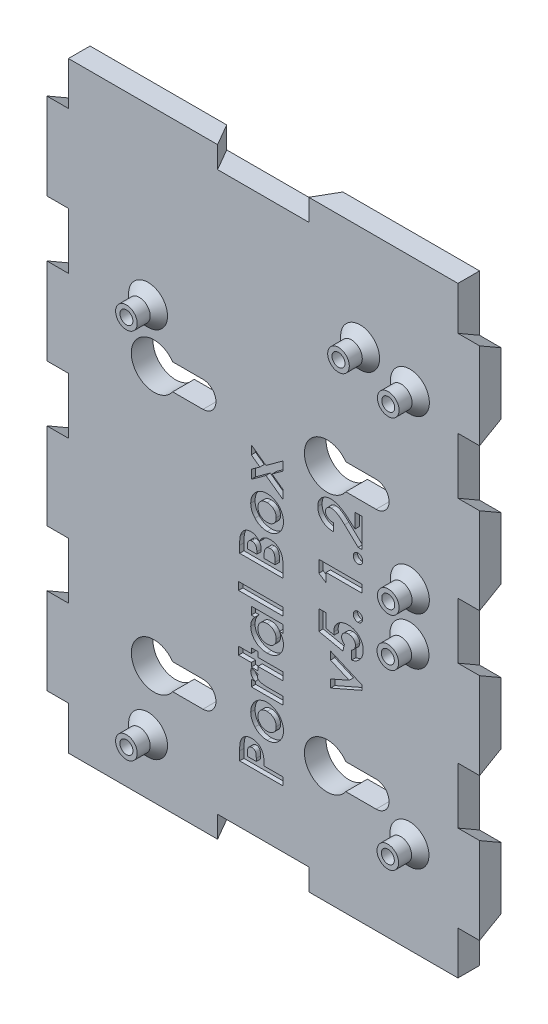
from build123d import *

# Parameters (mm, degrees)
SKETCH2_W           = 139
SKETCH2_H           = 90
BOSS_EXTRUDE1_DEPTH = 5
SKETCH9_W           = 10.256410256
SKETCH9_H           = 1.794871795
CUT_EXTRUDE4_DEPTH  = 1
CUT_EXTRUDE5_START  = -139
CUT_EXTRUDE5_DEPTH  = 5
CUT_EXTRUDE6_DEPTH  = 5
SKETCH11_R          = 2.5
SKETCH11_R_2        = 1.5
BOSS_EXTRUDE4_DEPTH = 5
CHAMFER1_SIZE       = 2
SKETCH14_R          = 3
SKETCH14_R_2        = 5.25
SKETCH14_W          = 7
SKETCH14_H          = 6
CUT_EXTRUDE7_DEPTH  = 10
BOSS_EXTRUDE5_DEPTH = 5
BOSS_EXTRUDE6_START = -95
BOSS_EXTRUDE6_DEPTH = 5


# Read off the part's stored shape, not the designer's step: Boss-Extrude6
with BuildPart() as part:
    # Sketch2 → Boss-Extrude1 (new body)
    with BuildSketch(Plane(origin=(0, 0, 0), x_dir=(0, 1, 0), z_dir=(0, 0, 1))):
        with Locations((-3.128165473, 4.557734887)):
            Rectangle(SKETCH2_W, SKETCH2_H)
    extrude(amount=BOSS_EXTRUDE1_DEPTH)

    # Sketch9 → Cut-Extrude4 (cut)
    # profile 1 of 15: a face of its own
    with BuildSketch(Plane.XY.offset(5)):
        Polygon((-7.307692308, 3.278324201), (-7.307692308, 5.303564585), (-5.31650641, 6.747875483), (-7.307692308, 8.186176765), (-7.307692308, 10.21542356), (-3.914262821, 7.765503688), (0, 10.604045355), (0, 8.57880497), (-2.514022436, 6.753885098), (0, 4.938981252), (0, 2.911737662), (-3.916266026, 5.738260098), align=None)
    # profile 2 of 15: a face of its own
    with BuildSketch(Plane.XY.offset(5)):
        with BuildLine():
            add(Edge.make_bspline(
                [(-7.435897436, -1.555409774), (-7.434407465, -1.470546816), (-7.431456647, -1.302479707), (-7.406267181, -1.052250616), (-7.36674023, -0.805909612), (-7.310008732, -0.56399627), (-7.240410266, -0.32513312), (-7.150987455, -0.0918583), (-7.049824026, 0.140122243), (-6.928945696, 0.364341578), (-6.798012815, 0.582629065), (-6.653334338, 0.789370862), (-6.496796946, 0.984156511), (-6.328904554, 1.166340788), (-6.149523708, 1.334866022), (-5.960579055, 1.492885158), (-5.758040214, 1.635970864), (-5.546285266, 1.768253773), (-5.326792116, 1.88607513), (-5.101019335, 1.988368001), (-4.872106573, 2.077152117), (-4.637260678, 2.146667436), (-4.399579685, 2.204219952), (-4.156150649, 2.240539627), (-3.90947429, 2.266360413), (-3.743391463, 2.269255741), (-3.659855769, 2.270712021)],
                knots=[0, 0, 0, 0, 1.022405107, 2.024825386, 3.027536274, 4.026883869, 5.01725043, 6.023055913, 7.035310063, 8.064783298, 9.090097283, 10.101295518, 11.102843468, 12.099336335, 13.084064592, 14.066917206, 15.06496821, 16.069711, 17.07409931, 18.064335113, 19.055093846, 20.030042637, 21.013718342, 21.999268124, 22.993679677, 24, 24, 24, 24], degree=3))
            add(Edge.make_bspline(
                [(-3.659855769, 2.270712021), (-3.575668071, 2.269173269), (-3.408283841, 2.26611388), (-3.159278085, 2.241495998), (-2.914738499, 2.200618988), (-2.673644475, 2.14834953), (-2.438588729, 2.07357614), (-2.205612467, 1.9897285), (-1.979083425, 1.8829183), (-1.755461771, 1.766383057), (-1.540158912, 1.635203938), (-1.336768855, 1.489614379), (-1.144918562, 1.333583009), (-0.963568705, 1.167641679), (-0.796863075, 0.988202729), (-0.642444818, 0.796856338), (-0.498230385, 0.595506754), (-0.367655927, 0.382638893), (-0.252922049, 0.160997408), (-0.149480851, -0.065684658), (-0.063358478, -0.298731497), (0.006871896, -0.537661158), (0.061249529, -0.782618448), (0.098188899, -1.03306259), (0.123879805, -1.288454214), (0.126754072, -1.460527035), (0.128205128, -1.547396953)],
                knots=[0, 0, 0, 0, 1.012065869, 2.012216375, 3.004733514, 3.992205109, 4.97496602, 5.968164778, 6.966799732, 7.983091762, 8.999225232, 9.995016355, 10.988052865, 11.970944933, 12.947950481, 13.92969433, 14.925485454, 15.92373309, 16.929186062, 17.924491632, 18.917690389, 19.913513875, 20.91665649, 21.931711093, 22.955836906, 24, 24, 24, 24], degree=3))
            add(Edge.make_bspline(
                [(0.128205128, -1.547396953), (0.124471894, -1.674415964), (0.117113634, -1.924772368), (0.066848044, -2.293531736), (-0.020053479, -2.647619015), (-0.139966739, -2.988681574), (-0.298345379, -3.313574767), (-0.486198013, -3.626698036), (-0.713954806, -3.921730701), (-0.968927167, -4.201612664), (-1.249598528, -4.456092363), (-1.547291058, -4.680649272), (-1.861058762, -4.869398586), (-2.189641277, -5.025158462), (-2.533594537, -5.145246176), (-2.891740299, -5.232002651), (-3.265125777, -5.282397761), (-3.518813134, -5.289684543), (-3.647836538, -5.293390543)],
                knots=[0, 0, 0, 0, 1.030098614, 2.030340051, 3.011502429, 3.982690393, 4.9563966, 5.938096863, 6.938909888, 7.973851373, 9.005145063, 10.007012469, 10.993347251, 11.969610266, 12.95101174, 13.942698978, 14.953672802, 16, 16, 16, 16], degree=3))
            add(Edge.make_bspline(
                [(-3.647836538, -5.293390543), (-3.785605389, -5.289555479), (-4.056387306, -5.282017737), (-4.453088986, -5.222164752), (-4.832912043, -5.126585991), (-5.194793994, -4.9893887), (-5.539402279, -4.814131228), (-5.866010082, -4.600181573), (-6.174691384, -4.346482383), (-6.361392418, -4.152199605), (-6.456330128, -4.053406568)],
                knots=[0, 0, 0, 0, 1.043912699, 2.05178951, 3.033892, 4.007821512, 4.978932272, 5.95884105, 6.962068106, 8, 8, 8, 8], degree=3))
            add(Edge.make_bspline(
                [(-6.456330128, -4.053406568), (-6.535022811, -3.962754082), (-6.690267185, -3.783915492), (-6.887169222, -3.493361643), (-7.05723251, -3.195867289), (-7.197056163, -2.887866831), (-7.302480942, -2.568501643), (-7.379220748, -2.239408291), (-7.426356586, -1.900655204), (-7.432700991, -1.671076416), (-7.435897436, -1.555409774)],
                knots=[0, 0, 0, 0, 1.048115528, 2.067714963, 3.060638214, 4.039924844, 5.017819947, 5.994373833, 6.98952318, 8, 8, 8, 8], degree=3))
        make_face()
        with BuildLine():
            add(Edge.make_bspline(
                [(-5.769230769, -1.515345671), (-5.767004691, -1.584862074), (-5.762622631, -1.721705861), (-5.737048603, -1.922573917), (-5.691392301, -2.114341059), (-5.622967027, -2.295642484), (-5.54246516, -2.471072187), (-5.439017506, -2.635685329), (-5.317524808, -2.790722063), (-5.180422884, -2.936789881), (-5.027135829, -3.067277302), (-4.863089682, -3.182998315), (-4.689253458, -3.281913213), (-4.502934477, -3.359255937), (-4.308221157, -3.422440624), (-4.102001422, -3.465355507), (-3.886421748, -3.495178076), (-3.738754329, -3.497394599), (-3.663862179, -3.498518748)],
                knots=[0, 0, 0, 0, 1.030405752, 2.028364813, 2.995676022, 3.944329772, 4.896127072, 5.85177522, 6.817820016, 7.811895093, 8.815529982, 9.795715103, 10.783861249, 11.772750455, 12.780524062, 13.813161006, 14.890905832, 16, 16, 16, 16], degree=3))
            add(Edge.make_bspline(
                [(-3.663862179, -3.498518748), (-3.586328066, -3.497205), (-3.43480253, -3.494637531), (-3.213560742, -3.468028718), (-3.003581637, -3.424197224), (-2.805292127, -3.361764119), (-2.617441171, -3.28403365), (-2.441819447, -3.186707734), (-2.277541156, -3.072415614), (-2.125249072, -2.94215665), (-1.987741893, -2.798562579), (-1.866130681, -2.644361071), (-1.766840988, -2.478237207), (-1.680551188, -2.305817202), (-1.617584181, -2.12228134), (-1.570315467, -1.930715746), (-1.545065027, -1.729021675), (-1.540692968, -1.59152926), (-1.538461538, -1.521355286)],
                knots=[0, 0, 0, 0, 1.141979911, 2.23178043, 3.277659926, 4.298338318, 5.290546728, 6.26815979, 7.25071132, 8.234641181, 9.215812446, 10.176243271, 11.121178574, 12.06282999, 13.01190517, 13.973595049, 14.965754676, 16, 16, 16, 16], degree=3))
            add(Edge.make_bspline(
                [(-1.538461538, -1.521355286), (-1.540436132, -1.451143529), (-1.544307482, -1.313487725), (-1.573297774, -1.111594689), (-1.618922786, -0.918912397), (-1.683312755, -0.734593645), (-1.767768961, -0.560128876), (-1.871213232, -0.394849436), (-1.991351927, -0.237304347), (-2.132027999, -0.092678221), (-2.284625793, 0.041165235), (-2.450073321, 0.158663087), (-2.626616168, 0.256090031), (-2.813264081, 0.338060155), (-3.011077021, 0.399139044), (-3.219675705, 0.442810905), (-3.437981009, 0.472549365), (-3.587638577, 0.474729725), (-3.663862179, 0.475840226)],
                knots=[0, 0, 0, 0, 1.03148129, 2.022302122, 2.990961611, 3.937500375, 4.885462201, 5.833017655, 6.798640665, 7.791063629, 8.792613068, 9.77817235, 10.766512052, 11.750898281, 12.768848897, 13.802335193, 14.880685208, 16, 16, 16, 16], degree=3))
            add(Edge.make_bspline(
                [(-3.663862179, 0.475840226), (-3.740061863, 0.47450911), (-3.889590361, 0.471897028), (-4.108152438, 0.445295355), (-4.31559259, 0.401861914), (-4.511025064, 0.338741295), (-4.696679437, 0.260833155), (-4.871605413, 0.164610903), (-5.034941436, 0.049091581), (-5.185877595, -0.081870116), (-5.322013979, -0.226713076), (-5.443414585, -0.380361831), (-5.543822213, -0.546329855), (-5.626593941, -0.721503489), (-5.690274971, -0.906348785), (-5.737544987, -1.100658225), (-5.762507927, -1.305027307), (-5.766966401, -1.444506856), (-5.769230769, -1.515345671)],
                knots=[0, 0, 0, 0, 1.123894411, 2.205445421, 3.243160173, 4.246488011, 5.231014757, 6.210004299, 7.185865357, 8.177612767, 9.153374344, 10.115157457, 11.061423229, 12.009021698, 12.96873347, 13.94135618, 14.954456845, 16, 16, 16, 16], degree=3))
        make_face(mode=Mode.SUBTRACT)
    # profile 3 of 15: a face of its own
    with BuildSketch(Plane.XY.offset(5)):
        with BuildLine():
            Line((0, -12.857493107), (-10, -12.857493107))
            Line((-10, -12.857493107), (-10, -11.254929004))
            add(Edge.make_bspline(
                [(-10, -11.254929004), (-10.000012804, -11.142739497), (-10.000037578, -10.925654927), (-9.98903915, -10.612458546), (-9.97481145, -10.321995353), (-9.958893963, -10.055189714), (-9.931464952, -9.811587508), (-9.902557771, -9.591559171), (-9.867697492, -9.394665086), (-9.836426741, -9.272936173), (-9.821714744, -9.215666184)],
                knots=[0, 0, 0, 0, 1.311965854, 2.538629056, 3.664479157, 4.713267157, 5.663616078, 6.530575999, 7.308677837, 8, 8, 8, 8], degree=3))
            add(Edge.make_bspline(
                [(-9.821714744, -9.215666184), (-9.800962389, -9.14046553), (-9.760239606, -8.992897706), (-9.678013079, -8.781522332), (-9.586556844, -8.581046283), (-9.482425519, -8.391513217), (-9.363676802, -8.215165357), (-9.232576532, -8.049582901), (-9.089076962, -7.895545156), (-8.932340636, -7.755473715), (-8.766449002, -7.629141055), (-8.591498887, -7.518572254), (-8.409403216, -7.424248066), (-8.219774044, -7.347227456), (-8.022848463, -7.289769444), (-7.81925039, -7.247636977), (-7.608245242, -7.220356367), (-7.464694924, -7.217776858), (-7.391826923, -7.216467466)],
                knots=[0, 0, 0, 0, 1.099825721, 2.158211141, 3.195041695, 4.206926465, 5.204905297, 6.190538631, 7.183526201, 8.170733634, 9.152262494, 10.121785545, 11.086538014, 12.041584943, 13.004265891, 13.975982849, 14.972582673, 16, 16, 16, 16], degree=3))
            add(Edge.make_bspline(
                [(-7.391826923, -7.216467466), (-7.298205909, -7.219880469), (-7.113924445, -7.226598546), (-6.843323774, -7.2697617), (-6.587861244, -7.349783012), (-6.343041209, -7.457063636), (-6.107356823, -7.598725916), (-5.88373598, -7.781894985), (-5.664457982, -7.999816753), (-5.533079141, -8.167111057), (-5.46474359, -8.254127722)],
                knots=[0, 0, 0, 0, 0.986208652, 1.941230559, 2.875571179, 3.798165321, 4.751009532, 5.761494368, 6.83566093, 8, 8, 8, 8], degree=3))
            add(Edge.make_bspline(
                [(-5.46474359, -8.254127722), (-5.428755274, -8.183619049), (-5.358192145, -8.045371048), (-5.24214026, -7.849160926), (-5.118957851, -7.667260955), (-4.990258784, -7.500281548), (-4.854111914, -7.347193317), (-4.710964492, -7.210441647), (-4.561517524, -7.086501919), (-4.404742079, -6.977809562), (-4.239834063, -6.884116601), (-4.069210879, -6.801686328), (-3.891357025, -6.730723312), (-3.705886703, -6.673058208), (-3.513034674, -6.628562738), (-3.313247471, -6.599994083), (-3.106785964, -6.578011958), (-2.966141858, -6.576308134), (-2.89463141, -6.575441825)],
                knots=[0, 0, 0, 0, 1.164539168, 2.28333912, 3.351515688, 4.395009163, 5.383055728, 6.362812631, 7.305003804, 8.237049474, 9.165619381, 10.092784925, 11.02322402, 11.98030579, 12.947919037, 13.931657808, 14.948352129, 16, 16, 16, 16], degree=3))
            add(Edge.make_bspline(
                [(-2.89463141, -6.575441825), (-2.758048413, -6.581069779), (-2.488502415, -6.592176524), (-2.09280593, -6.67358192), (-1.717969884, -6.813958206), (-1.365969739, -7.004261821), (-1.045433796, -7.237576333), (-0.762353174, -7.504409447), (-0.524506972, -7.805566554), (-0.363771282, -8.082580516), (-0.256079566, -8.322296479), (-0.189191544, -8.52077417), (-0.128452616, -8.734318735), (-0.080925963, -8.965353701), (-0.045608649, -9.212295266), (-0.019850651, -9.474979267), (-0.003612765, -9.754326621), (-0.001228602, -9.946145454), (0, -10.044993107)],
                knots=[0, 0, 0, 0, 1.284195246, 2.534354168, 3.78027825, 5.036354521, 6.286276797, 7.499025881, 8.683874548, 9.882754589, 10.501292686, 11.152751137, 11.850656415, 12.588451682, 13.369156733, 14.195917516, 15.070324243, 16, 16, 16, 16], degree=3))
            Line((0, -10.044993107), (0, -12.857493107))
        make_face()
        with BuildLine():
            Line((-8.205128205, -11.062621312), (-6.025641026, -11.062621312))
            Line((-6.025641026, -11.062621312), (-6.025641026, -10.585858492))
            add(Edge.make_bspline(
                [(-6.025641026, -10.585858492), (-6.026206074, -10.521062141), (-6.027296867, -10.395976707), (-6.041345893, -10.215304066), (-6.065314404, -10.047307687), (-6.098756507, -9.892624745), (-6.141223102, -9.749814312), (-6.192319561, -9.619788701), (-6.254662795, -9.503119612), (-6.347525793, -9.367577115), (-6.484177852, -9.224298922), (-6.681600064, -9.098172739), (-6.908634858, -9.02388526), (-7.068757373, -9.015611638), (-7.151442308, -9.011339261)],
                knots=[0, 0, 0, 0, 1.065314748, 2.056525647, 2.977365736, 3.853934255, 4.656397591, 5.425096493, 6.14721249, 6.826394842, 8.123232004, 9.372140726, 10.643011755, 12, 12, 12, 12], degree=3))
            add(Edge.make_bspline(
                [(-7.151442308, -9.011339261), (-7.228890682, -9.014757891), (-7.378634002, -9.021367676), (-7.58888375, -9.096166354), (-7.775220502, -9.212339566), (-7.902712802, -9.349510768), (-7.989881131, -9.478655603), (-8.046989059, -9.589320863), (-8.09923202, -9.71026978), (-8.134470721, -9.845856431), (-8.168183505, -9.991734841), (-8.18857625, -10.150726767), (-8.203664823, -10.321141564), (-8.204629948, -10.43891747), (-8.205128205, -10.499720671)],
                knots=[0, 0, 0, 0, 1.348076466, 2.606451671, 3.849585156, 5.153713056, 5.843081946, 6.568636199, 7.327130502, 8.139792284, 9.011860696, 9.942616599, 10.937851541, 12, 12, 12, 12], degree=3))
            Line((-8.205128205, -10.499720671), (-8.205128205, -11.062621312))
        make_face(mode=Mode.SUBTRACT)
        with BuildLine():
            Line((-4.358974359, -11.062621312), (-1.794871795, -11.062621312))
            Line((-1.794871795, -11.062621312), (-1.794871795, -10.545794389))
            add(Edge.make_bspline(
                [(-1.794871795, -10.545794389), (-1.795466042, -10.443619561), (-1.796608555, -10.247175704), (-1.81003052, -9.965730287), (-1.834924714, -9.709964708), (-1.863989887, -9.479818783), (-1.90994673, -9.277176306), (-1.957730014, -9.098336342), (-2.019192749, -8.946397897), (-2.090467506, -8.818768031), (-2.171092026, -8.712026335), (-2.258348479, -8.61959539), (-2.355848533, -8.542501072), (-2.461435382, -8.480500076), (-2.574134734, -8.428416777), (-2.697687482, -8.396511691), (-2.8282513, -8.372333938), (-2.918545823, -8.370997425), (-2.96474359, -8.37031362)],
                knots=[0, 0, 0, 0, 1.753677247, 3.371663338, 4.833688836, 6.164395063, 7.349095089, 8.3975697, 9.338276771, 10.154261968, 10.899224605, 11.628775934, 12.330426574, 13.024264642, 13.727131073, 14.452891561, 15.208446408, 16, 16, 16, 16], degree=3))
            add(Edge.make_bspline(
                [(-2.96474359, -8.37031362), (-3.017574234, -8.371814404), (-3.120474117, -8.374737527), (-3.270849348, -8.398681911), (-3.411325504, -8.442015346), (-3.545594884, -8.497407919), (-3.66981429, -8.57234362), (-3.785873328, -8.663615804), (-3.890966053, -8.77285347), (-3.991236099, -8.895956373), (-4.079755171, -9.038839586), (-4.153085297, -9.203905813), (-4.217592947, -9.388656222), (-4.26807996, -9.596191581), (-4.311230142, -9.824657307), (-4.336923659, -10.07592837), (-4.356058206, -10.34784933), (-4.357980221, -10.536406531), (-4.358974359, -10.633935415)],
                knots=[0, 0, 0, 0, 0.844975127, 1.645784239, 2.426462591, 3.192310282, 3.963577212, 4.739343514, 5.547598874, 6.383408773, 7.27567655, 8.226932621, 9.267447238, 10.402227125, 11.640487588, 12.984111775, 14.440069075, 16, 16, 16, 16], degree=3))
            Line((-4.358974359, -10.633935415), (-4.358974359, -11.062621312))
        make_face(mode=Mode.SUBTRACT)
    # profile 4 of 15: a face of its own
    with BuildSketch(Plane.XY.offset(5)):
        with Locations((-5.128205128, -19.524159774)):
            Rectangle(SKETCH9_W, SKETCH9_H)
    # profile 5 of 15: a face of its own
    with BuildSketch(Plane.XY.offset(5)):
        with BuildLine():
            Line((-7.307692308, -23.883134133), (-7.307692308, -22.088262338))
            Line((-7.307692308, -22.088262338), (0, -22.088262338))
            Line((0, -22.088262338), (0, -23.883134133))
            Line((0, -23.883134133), (-0.797275641, -23.883134133))
            add(Edge.make_bspline(
                [(-0.797275641, -23.883134133), (-0.719891253, -23.972222035), (-0.569447019, -24.145419259), (-0.370992159, -24.415377081), (-0.212885531, -24.690090095), (-0.083869932, -24.964187458), (0.010736046, -25.245508679), (0.079429324, -25.535031646), (0.119893452, -25.837120426), (0.12540571, -26.042468989), (0.128205128, -26.146755927)],
                knots=[0, 0, 0, 0, 1.129123921, 2.195147974, 3.200207348, 4.157999811, 5.089597333, 6.035096005, 7.002117093, 8, 8, 8, 8], degree=3))
            add(Edge.make_bspline(
                [(0.128205128, -26.146755927), (0.125572536, -26.263824062), (0.120370386, -26.49515733), (0.065572033, -26.834600784), (-0.018228957, -27.162415568), (-0.137109972, -27.478105004), (-0.290241871, -27.782284101), (-0.478201672, -28.073244583), (-0.697590914, -28.354036457), (-0.950663886, -28.616695765), (-1.225664551, -28.86037429), (-1.522261522, -29.071583209), (-1.834519125, -29.251622192), (-2.163884365, -29.397422269), (-2.509186281, -29.512757238), (-2.871400636, -29.594858379), (-3.250544786, -29.6433262), (-3.50880721, -29.649322818), (-3.639823718, -29.652364902)],
                knots=[0, 0, 0, 0, 0.980565623, 1.937653242, 2.874408941, 3.813202629, 4.759425872, 5.723639668, 6.712366934, 7.741707894, 8.776921788, 9.78808311, 10.788528848, 11.79333378, 12.802261723, 13.835597484, 14.901998771, 16, 16, 16, 16], degree=3))
            add(Edge.make_bspline(
                [(-3.639823718, -29.652364902), (-3.775492239, -29.649174141), (-4.04162116, -29.642915109), (-4.432133425, -29.597057407), (-4.803367329, -29.516571034), (-5.156085579, -29.405988293), (-5.490395816, -29.266198089), (-5.804952552, -29.092347138), (-6.100884869, -28.88688111), (-6.374925283, -28.652211592), (-6.622522878, -28.394664478), (-6.839266993, -28.121345307), (-7.026899237, -27.83617291), (-7.174174486, -27.533541089), (-7.291353416, -27.219630631), (-7.376208876, -26.892268614), (-7.427333828, -26.551024983), (-7.433019194, -26.318539373), (-7.435897436, -26.200842466)],
                knots=[0, 0, 0, 0, 1.136200099, 2.228783096, 3.287341693, 4.313263682, 5.320819933, 6.317074962, 7.317731395, 8.33320375, 9.333922696, 10.3051871, 11.251461974, 12.186899125, 13.117710514, 14.053682506, 15.014667834, 16, 16, 16, 16], degree=3))
            add(Edge.make_bspline(
                [(-7.435897436, -26.200842466), (-7.43368956, -26.091806306), (-7.429320968, -25.876063048), (-7.379855681, -25.559329835), (-7.309383464, -25.251270141), (-7.204343573, -24.954730495), (-7.069196842, -24.66827665), (-6.903856263, -24.393953406), (-6.711203593, -24.128086445), (-6.560918702, -23.965793716), (-6.484375, -23.883134133)],
                knots=[0, 0, 0, 0, 1.016860689, 2.012000776, 2.985574089, 3.963288254, 4.94189597, 5.937036056, 6.949282938, 8, 8, 8, 8], degree=3))
            Line((-6.484375, -23.883134133), (-7.307692308, -23.883134133))
        make_face()
        with BuildLine():
            add(Edge.make_bspline(
                [(-5.769230769, -25.824239902), (-5.767035322, -25.895759679), (-5.762732389, -26.035933771), (-5.736874743, -26.242088722), (-5.691238985, -26.439073514), (-5.624075319, -26.625658659), (-5.54152402, -26.803668304), (-5.441496929, -26.973140075), (-5.31957779, -27.131641159), (-5.182471069, -27.280753468), (-5.031579215, -27.41761226), (-4.865616608, -27.532689737), (-4.692560985, -27.634864586), (-4.507884514, -27.717282276), (-4.311809108, -27.778295584), (-4.106512299, -27.825904968), (-3.89016077, -27.850729202), (-3.742707387, -27.855215912), (-3.66786859, -27.857493107)],
                knots=[0, 0, 0, 0, 1.048146026, 2.054297773, 3.039291333, 4.004895774, 4.954855183, 5.911393651, 6.882091317, 7.879305688, 8.877191939, 9.859995919, 10.833402353, 11.818978979, 12.815424932, 13.838562528, 14.902979527, 16, 16, 16, 16], degree=3))
            add(Edge.make_bspline(
                [(-3.66786859, -27.857493107), (-3.592351852, -27.855248717), (-3.443546997, -27.850826174), (-3.225357781, -27.825527084), (-3.017108166, -27.779532363), (-2.820643802, -27.712202756), (-2.633254891, -27.630989702), (-2.456906276, -27.529080601), (-2.29081979, -27.409261008), (-2.137190275, -27.270858928), (-1.997930674, -27.119731858), (-1.87521894, -26.958802833), (-1.769272998, -26.789985501), (-1.686389004, -26.610942006), (-1.618244451, -26.425139576), (-1.57327999, -26.229264285), (-1.544490497, -26.02541436), (-1.540485068, -25.88643767), (-1.538461538, -25.816227081)],
                knots=[0, 0, 0, 0, 1.099325991, 2.166209118, 3.191924645, 4.196940947, 5.184751095, 6.160002295, 7.155385631, 8.160260941, 9.164478025, 10.142244259, 11.102414478, 12.058888405, 13.008821923, 13.977708232, 14.978344536, 16, 16, 16, 16], degree=3))
            add(Edge.make_bspline(
                [(-1.538461538, -25.816227081), (-1.540667344, -25.743373987), (-1.544991921, -25.600542318), (-1.570640952, -25.391040685), (-1.616343527, -25.19134906), (-1.684257199, -25.002478232), (-1.765161794, -24.820569096), (-1.868675144, -24.650071697), (-1.989230405, -24.488790932), (-2.127929908, -24.339725222), (-2.278007597, -24.200883268), (-2.444764629, -24.082817733), (-2.620722705, -23.979182133), (-2.810343716, -23.89781346), (-3.010120951, -23.833158053), (-3.221346091, -23.786778828), (-3.444232556, -23.761549019), (-3.596361813, -23.757163576), (-3.673878205, -23.754929004)],
                knots=[0, 0, 0, 0, 1.050155102, 2.058874885, 3.037059141, 3.995876228, 4.947712252, 5.901735345, 6.864168349, 7.84500044, 8.832936864, 9.80518476, 10.78407896, 11.771077351, 12.772424026, 13.806938781, 14.882541092, 16, 16, 16, 16], degree=3))
            add(Edge.make_bspline(
                [(-3.673878205, -23.754929004), (-3.75006225, -23.757133746), (-3.898871821, -23.761440246), (-4.11709196, -23.786910392), (-4.324215166, -23.833514286), (-4.520920878, -23.897403581), (-4.70714149, -23.979197161), (-4.879303805, -24.083424827), (-5.04385398, -24.200834903), (-5.191605923, -24.339940443), (-5.32942011, -24.488362172), (-5.444417603, -24.652514982), (-5.546073444, -24.823102261), (-5.62905905, -25.004141232), (-5.690049436, -25.196284649), (-5.737226857, -25.396295612), (-5.762720378, -25.607243881), (-5.767025225, -25.750727518), (-5.769230769, -25.824239902)],
                knots=[0, 0, 0, 0, 1.106392033, 2.161105042, 3.184375597, 4.183944285, 5.160535686, 6.12997743, 7.101598623, 8.089721671, 9.071306002, 10.0372504, 10.99341283, 11.95232427, 12.921232515, 13.916134811, 14.932352853, 16, 16, 16, 16], degree=3))
        make_face(mode=Mode.SUBTRACT)
    # profile 6 of 15: a face of its own
    with BuildSketch(Plane.XY.offset(5)):
        Polygon((-10.256410256, -33.37031362), (-10.256410256, -31.575441825), (-7.307692308, -31.575441825), (-7.307692308, -30.421595671), (-5.769230769, -30.421595671), (-5.769230769, -31.575441825), (0, -31.575441825), (0, -33.37031362), (-5.769230769, -33.37031362), (-5.769230769, -34.267749517), (-7.307692308, -34.267749517), (-7.307692308, -33.37031362), align=None)
    # profile 7 of 15: a face of its own
    with BuildSketch(Plane.XY.offset(5)):
        with BuildLine():
            Line((-7.307692308, -38.242108492), (-7.307692308, -36.703646953))
            Line((-7.307692308, -36.703646953), (-6.408253205, -36.703646953))
            add(Edge.make_bspline(
                [(-6.408253205, -36.703646953), (-6.488224403, -36.660163712), (-6.644531427, -36.575173914), (-6.854095396, -36.418111), (-7.032860121, -36.24001471), (-7.179685983, -36.042786473), (-7.295273052, -35.829672231), (-7.373864991, -35.603334901), (-7.427751525, -35.368687172), (-7.433162581, -35.208225198), (-7.435897436, -35.127124517)],
                knots=[0, 0, 0, 0, 1.098257011, 2.14658889, 3.150171462, 4.135608708, 5.106151504, 6.065202199, 7.022114616, 8, 8, 8, 8], degree=3))
            add(Edge.make_bspline(
                [(-7.435897436, -35.127124517), (-7.433391248, -35.068198224), (-7.428282632, -34.948082781), (-7.391611889, -34.766261851), (-7.336672642, -34.579846073), (-7.283047718, -34.458198927), (-7.255608974, -34.395954645)],
                knots=[0, 0, 0, 0, 0.931681262, 1.899140464, 2.92503444, 4, 4, 4, 4], degree=3))
            Line((-7.255608974, -34.395954645), (-5.735176282, -34.952845671))
            add(Edge.make_bspline(
                [(-5.735176282, -34.952845671), (-5.759226656, -35.002623776), (-5.8044321, -35.096187452), (-5.857779182, -35.232025663), (-5.890328963, -35.355304472), (-5.895185676, -35.433460974), (-5.897435897, -35.469672594)],
                knots=[0, 0, 0, 0, 1.214386998, 2.282580073, 3.20428172, 4, 4, 4, 4], degree=3))
            add(Edge.make_bspline(
                [(-5.897435897, -35.469672594), (-5.895957416, -35.503871915), (-5.893048988, -35.571147871), (-5.867727629, -35.670296569), (-5.824960491, -35.764608668), (-5.766518998, -35.854782575), (-5.692118001, -35.940602436), (-5.602233457, -36.023247306), (-5.492150948, -36.097144092), (-5.369263737, -36.174847769), (-5.218968755, -36.241082502), (-5.039510148, -36.297853204), (-4.828855007, -36.348444389), (-4.585870448, -36.383255831), (-4.312912467, -36.416903392), (-4.007976076, -36.436931043), (-3.672025987, -36.451857978), (-3.437520679, -36.452770655), (-3.315304487, -36.453246312)],
                knots=[0, 0, 0, 0, 0.544275934, 1.070684535, 1.618381339, 2.187962168, 2.776504876, 3.424199031, 4.126721978, 4.885782074, 5.738130428, 6.734037679, 7.882403433, 9.185545758, 10.642483747, 12.263902275, 14.052872929, 16, 16, 16, 16], degree=3))
            Line((-3.315304487, -36.453246312), (-2.958733974, -36.447236697))
            Line((-2.958733974, -36.447236697), (0, -36.447236697))
            Line((0, -36.447236697), (0, -38.242108492))
            Line((0, -38.242108492), (-7.307692308, -38.242108492))
        make_face()
    # profile 8 of 15: a face of its own
    with BuildSketch(Plane.XY.offset(5)):
        with BuildLine():
            add(Edge.make_bspline(
                [(-7.435897436, -43.350281568), (-7.434407465, -43.265418611), (-7.431456647, -43.097351502), (-7.406267181, -42.847122411), (-7.36674023, -42.600781407), (-7.310008732, -42.358868065), (-7.240410266, -42.120004915), (-7.150987455, -41.886730095), (-7.049824026, -41.654749552), (-6.928945696, -41.430530217), (-6.798012815, -41.21224273), (-6.653334338, -41.005500933), (-6.496796946, -40.810715284), (-6.328904554, -40.628531007), (-6.149523708, -40.460005773), (-5.960579055, -40.301986636), (-5.758040214, -40.158900931), (-5.546285266, -40.026618022), (-5.326792116, -39.908796665), (-5.101019335, -39.806503794), (-4.872106573, -39.717719678), (-4.637260678, -39.648204359), (-4.399579685, -39.590651843), (-4.156150649, -39.554332168), (-3.90947429, -39.528511382), (-3.743391463, -39.525616054), (-3.659855769, -39.524159774)],
                knots=[0, 0, 0, 0, 1.022405107, 2.024825386, 3.027536274, 4.026883869, 5.01725043, 6.023055913, 7.035310063, 8.064783298, 9.090097283, 10.101295518, 11.102843468, 12.099336335, 13.084064592, 14.066917206, 15.06496821, 16.069711, 17.07409931, 18.064335113, 19.055093846, 20.030042637, 21.013718342, 21.999268124, 22.993679677, 24, 24, 24, 24], degree=3))
            add(Edge.make_bspline(
                [(-3.659855769, -39.524159774), (-3.575668071, -39.525698526), (-3.408283841, -39.528757915), (-3.159278085, -39.553375797), (-2.914738499, -39.594252807), (-2.673644475, -39.646522265), (-2.438588729, -39.721295655), (-2.205612467, -39.805143295), (-1.979083425, -39.911953495), (-1.755461771, -40.028488738), (-1.540158912, -40.159667857), (-1.336768855, -40.305257416), (-1.144918562, -40.461288786), (-0.963568705, -40.627230116), (-0.796863075, -40.806669066), (-0.642444818, -40.998015457), (-0.498230385, -41.199365041), (-0.367655927, -41.412232902), (-0.252922049, -41.633874387), (-0.149480851, -41.860556453), (-0.063358478, -42.093603292), (0.006871896, -42.332532953), (0.061249529, -42.577490242), (0.098188899, -42.827934385), (0.123879805, -43.083326009), (0.126754072, -43.25539883), (0.128205128, -43.342268748)],
                knots=[0, 0, 0, 0, 1.012065869, 2.012216375, 3.004733514, 3.992205109, 4.97496602, 5.968164778, 6.966799732, 7.983091762, 8.999225232, 9.995016355, 10.988052865, 11.970944933, 12.947950481, 13.92969433, 14.925485454, 15.92373309, 16.929186062, 17.924491632, 18.917690389, 19.913513875, 20.91665649, 21.931711093, 22.955836906, 24, 24, 24, 24], degree=3))
            add(Edge.make_bspline(
                [(0.128205128, -43.342268748), (0.124471894, -43.469287759), (0.117113634, -43.719644163), (0.066848044, -44.08840353), (-0.020053479, -44.442490809), (-0.139966739, -44.783553368), (-0.298345379, -45.108446562), (-0.486198013, -45.421569831), (-0.713954806, -45.716602496), (-0.968927167, -45.996484459), (-1.249598528, -46.250964158), (-1.547291058, -46.475521067), (-1.861058762, -46.664270381), (-2.189641277, -46.820030257), (-2.533594537, -46.940117971), (-2.891740299, -47.026874446), (-3.265125777, -47.077269556), (-3.518813134, -47.084556338), (-3.647836538, -47.088262338)],
                knots=[0, 0, 0, 0, 1.030098614, 2.030340051, 3.011502429, 3.982690393, 4.9563966, 5.938096863, 6.938909888, 7.973851373, 9.005145063, 10.007012469, 10.993347251, 11.969610266, 12.95101174, 13.942698978, 14.953672802, 16, 16, 16, 16], degree=3))
            add(Edge.make_bspline(
                [(-3.647836538, -47.088262338), (-3.785605389, -47.084427274), (-4.056387306, -47.076889532), (-4.453088986, -47.017036547), (-4.832912043, -46.921457786), (-5.194793994, -46.784260495), (-5.539402279, -46.609003023), (-5.866010082, -46.395053368), (-6.174691384, -46.141354178), (-6.361392418, -45.9470714), (-6.456330128, -45.848278363)],
                knots=[0, 0, 0, 0, 1.043912699, 2.05178951, 3.033892, 4.007821512, 4.978932272, 5.95884105, 6.962068106, 8, 8, 8, 8], degree=3))
            add(Edge.make_bspline(
                [(-6.456330128, -45.848278363), (-6.535022811, -45.757625877), (-6.690267185, -45.578787287), (-6.887169222, -45.288233438), (-7.05723251, -44.990739084), (-7.197056163, -44.682738625), (-7.302480942, -44.363373438), (-7.379220748, -44.034280085), (-7.426356586, -43.695526999), (-7.432700991, -43.465948211), (-7.435897436, -43.350281568)],
                knots=[0, 0, 0, 0, 1.048115528, 2.067714963, 3.060638214, 4.039924844, 5.017819947, 5.994373833, 6.98952318, 8, 8, 8, 8], degree=3))
        make_face()
        with BuildLine():
            add(Edge.make_bspline(
                [(-5.769230769, -43.310217466), (-5.767004691, -43.379733869), (-5.762622631, -43.516577656), (-5.737048603, -43.717445712), (-5.691392301, -43.909212854), (-5.622967027, -44.090514279), (-5.54246516, -44.265943982), (-5.439017506, -44.430557124), (-5.317524808, -44.585593858), (-5.180422884, -44.731661676), (-5.027135829, -44.862149097), (-4.863089682, -44.97787011), (-4.689253458, -45.076785008), (-4.502934477, -45.154127732), (-4.308221157, -45.217312419), (-4.102001422, -45.260227302), (-3.886421748, -45.290049871), (-3.738754329, -45.292266394), (-3.663862179, -45.293390543)],
                knots=[0, 0, 0, 0, 1.030405752, 2.028364813, 2.995676022, 3.944329772, 4.896127072, 5.85177522, 6.817820016, 7.811895093, 8.815529982, 9.795715103, 10.783861249, 11.772750455, 12.780524062, 13.813161006, 14.890905832, 16, 16, 16, 16], degree=3))
            add(Edge.make_bspline(
                [(-3.663862179, -45.293390543), (-3.586328066, -45.292076795), (-3.43480253, -45.289509326), (-3.213560742, -45.262900513), (-3.003581637, -45.219069018), (-2.805292127, -45.156635914), (-2.617441171, -45.078905445), (-2.441819447, -44.981579529), (-2.277541156, -44.867287409), (-2.125249072, -44.737028445), (-1.987741893, -44.593434374), (-1.866130681, -44.439232865), (-1.766840988, -44.273109001), (-1.680551188, -44.100688996), (-1.617584181, -43.917153134), (-1.570315467, -43.725587541), (-1.545065027, -43.52389347), (-1.540692968, -43.386401055), (-1.538461538, -43.316227081)],
                knots=[0, 0, 0, 0, 1.141979911, 2.23178043, 3.277659926, 4.298338318, 5.290546728, 6.26815979, 7.25071132, 8.234641181, 9.215812446, 10.176243271, 11.121178574, 12.06282999, 13.01190517, 13.973595049, 14.965754676, 16, 16, 16, 16], degree=3))
            add(Edge.make_bspline(
                [(-1.538461538, -43.316227081), (-1.540436132, -43.246015324), (-1.544307482, -43.10835952), (-1.573297774, -42.906466484), (-1.618922786, -42.713784192), (-1.683312755, -42.52946544), (-1.767768961, -42.355000671), (-1.871213232, -42.189721231), (-1.991351927, -42.032176142), (-2.132027999, -41.887550016), (-2.284625793, -41.753706559), (-2.450073321, -41.636208708), (-2.626616168, -41.538781764), (-2.813264081, -41.45681164), (-3.011077021, -41.395732751), (-3.219675705, -41.35206089), (-3.437981009, -41.32232243), (-3.587638577, -41.32014207), (-3.663862179, -41.319031568)],
                knots=[0, 0, 0, 0, 1.03148129, 2.022302122, 2.990961611, 3.937500375, 4.885462201, 5.833017655, 6.798640665, 7.791063629, 8.792613068, 9.77817235, 10.766512052, 11.750898281, 12.768848897, 13.802335193, 14.880685208, 16, 16, 16, 16], degree=3))
            add(Edge.make_bspline(
                [(-3.663862179, -41.319031568), (-3.740061863, -41.320362685), (-3.889590361, -41.322974767), (-4.108152438, -41.34957644), (-4.31559259, -41.393009881), (-4.511025064, -41.4561305), (-4.696679437, -41.53403864), (-4.871605413, -41.630260892), (-5.034941436, -41.745780214), (-5.185877595, -41.876741911), (-5.322013979, -42.021584871), (-5.443414585, -42.175233626), (-5.543822213, -42.34120165), (-5.626593941, -42.516375284), (-5.690274971, -42.70122058), (-5.737544987, -42.89553002), (-5.762507927, -43.099899102), (-5.766966401, -43.239378651), (-5.769230769, -43.310217466)],
                knots=[0, 0, 0, 0, 1.123894411, 2.205445421, 3.243160173, 4.246488011, 5.231014757, 6.210004299, 7.185865357, 8.177612767, 9.153374344, 10.115157457, 11.061423229, 12.009021698, 12.96873347, 13.94135618, 14.954456845, 16, 16, 16, 16], degree=3))
        make_face(mode=Mode.SUBTRACT)
    # profile 9 of 15: a face of its own
    with BuildSketch(Plane.XY.offset(5)):
        with BuildLine():
            Line((-10, -54.395954645), (-10, -52.392749517))
            add(Edge.make_bspline(
                [(-10, -52.392749517), (-9.999414124, -52.261862692), (-9.998283846, -52.009354571), (-9.984577683, -51.645217098), (-9.960015473, -51.309282404), (-9.929660262, -51.001627872), (-9.887104127, -50.722379341), (-9.838314745, -50.471189244), (-9.778881939, -50.247998596), (-9.708314158, -50.050312639), (-9.625190274, -49.87284116), (-9.536404761, -49.705093234), (-9.43116328, -49.54959358), (-9.317051845, -49.402691509), (-9.191696468, -49.265498262), (-9.05559258, -49.136997211), (-8.906762196, -49.018511559), (-8.746230623, -48.910784136), (-8.577266173, -48.813005072), (-8.399483534, -48.727592953), (-8.212624023, -48.658307799), (-8.017890291, -48.600187189), (-7.815292505, -48.553503877), (-7.603584205, -48.522430044), (-7.384243748, -48.501323114), (-7.23496049, -48.49946072), (-7.159455128, -48.498518748)],
                knots=[0, 0, 0, 0, 1.698787518, 3.27731721, 4.728409951, 6.070286353, 7.288646904, 8.393455548, 9.389990496, 10.283725379, 11.113616976, 11.931887102, 12.744353494, 13.547053751, 14.344590688, 15.153907614, 15.974148981, 16.810666655, 17.660988447, 18.506082349, 19.367288142, 20.244738011, 21.142497992, 22.06302001, 23.020302899, 24, 24, 24, 24], degree=3))
            add(Edge.make_bspline(
                [(-7.159455128, -48.498518748), (-7.075925345, -48.499881665), (-6.911779056, -48.502559965), (-6.671160728, -48.528815921), (-6.441752967, -48.573669413), (-6.221620998, -48.632290505), (-6.014386979, -48.714033731), (-5.815104415, -48.807420554), (-5.629367264, -48.922319636), (-5.454827134, -49.053596783), (-5.29015844, -49.19701608), (-5.139768716, -49.355750804), (-5.003702879, -49.527931298), (-4.876076791, -49.708775858), (-4.767109442, -49.905736285), (-4.665466485, -50.111917681), (-4.579341442, -50.332510647), (-4.534136612, -50.48600316), (-4.511217949, -50.563823235)],
                knots=[0, 0, 0, 0, 1.101964615, 2.165495883, 3.188506962, 4.184641065, 5.166448333, 6.124117473, 7.085225874, 8.042124548, 9.003636759, 9.963451826, 10.9225791, 11.897800977, 12.880319672, 13.889154746, 14.929810112, 16, 16, 16, 16], degree=3))
            add(Edge.make_bspline(
                [(-4.511217949, -50.563823235), (-4.49846351, -50.615086723), (-4.470833288, -50.726139947), (-4.442781678, -50.909902529), (-4.416989947, -51.121669612), (-4.394825077, -51.362125975), (-4.37975813, -51.631410248), (-4.367991515, -51.929261694), (-4.35943597, -52.255815294), (-4.359132382, -52.482887754), (-4.358974359, -52.601082851)],
                knots=[0, 0, 0, 0, 0.618981996, 1.340914327, 2.176866532, 3.120127938, 4.170906482, 5.338178032, 6.614476169, 8, 8, 8, 8], degree=3))
            Line((-4.358974359, -52.601082851), (0, -52.601082851))
            Line((0, -52.601082851), (0, -54.395954645))
            Line((0, -54.395954645), (-10, -54.395954645))
        make_face()
        with BuildLine():
            Line((-6.153846154, -52.601082851), (-6.153846154, -51.966066825))
            add(Edge.make_bspline(
                [(-6.153846154, -51.966066825), (-6.15457872, -51.850515496), (-6.155926652, -51.637899335), (-6.175423029, -51.347542647), (-6.205192167, -51.114200865), (-6.247903071, -50.929871241), (-6.312679174, -50.784283486), (-6.387744063, -50.658865559), (-6.482521902, -50.550397837), (-6.59264635, -50.458472323), (-6.716699473, -50.383774705), (-6.854348887, -50.331267008), (-7.003631725, -50.298155676), (-7.107858432, -50.295008842), (-7.161458333, -50.293390543)],
                knots=[0, 0, 0, 0, 1.862197296, 3.426470689, 4.686743892, 5.65255712, 6.462325617, 7.244961981, 8.000258385, 8.771939908, 9.549006364, 10.32248703, 11.137317743, 12, 12, 12, 12], degree=3))
            add(Edge.make_bspline(
                [(-7.161458333, -50.293390543), (-7.208300285, -50.294957743), (-7.299184935, -50.297998487), (-7.43026177, -50.320644482), (-7.552212769, -50.35579222), (-7.663337967, -50.409508719), (-7.76622926, -50.474725444), (-7.857683616, -50.557460971), (-7.940659893, -50.652872038), (-7.984525239, -50.726657344), (-8.006810897, -50.764143748)],
                knots=[0, 0, 0, 0, 1.102449765, 2.139017612, 3.12397484, 4.080535277, 5.035673127, 5.982361139, 6.974944601, 8, 8, 8, 8], degree=3))
            add(Edge.make_bspline(
                [(-8.006810897, -50.764143748), (-8.022865317, -50.795888872), (-8.056855813, -50.863099806), (-8.09637225, -50.977566541), (-8.129708718, -51.109659406), (-8.157377665, -51.260270176), (-8.178851641, -51.428798022), (-8.19527386, -51.615212874), (-8.201877875, -51.819789061), (-8.204014878, -51.962059558), (-8.205128205, -52.036179004)],
                knots=[0, 0, 0, 0, 0.656809284, 1.390599849, 2.23162475, 3.173112763, 4.218524733, 5.370385145, 6.63003504, 8, 8, 8, 8], degree=3))
            Line((-8.205128205, -52.036179004), (-8.205128205, -52.601082851))
            Line((-8.205128205, -52.601082851), (-6.153846154, -52.601082851))
        make_face(mode=Mode.SUBTRACT)
    # profile 10 of 15: a face of its own
    with BuildSketch(Plane.XY.offset(5)):
        with BuildLine():
            Line((11.641025641, 4.065583816), (11.641025641, 2.270712021))
            add(Edge.make_bspline(
                [(11.641025641, 2.270712021), (11.505251665, 2.278460754), (11.239957466, 2.293601312), (10.854632976, 2.353892683), (10.490454618, 2.434473464), (10.148517254, 2.542937187), (9.828677227, 2.676534593), (9.531993989, 2.838590768), (9.256341666, 3.024267293), (9.006554649, 3.237306826), (8.781988525, 3.469063125), (8.585666925, 3.718942044), (8.421320071, 3.98623377), (8.286505596, 4.269150983), (8.178636653, 4.566582418), (8.106555503, 4.881533198), (8.057730881, 5.211224294), (8.053459222, 5.436926549), (8.051282051, 5.551962021)],
                knots=[0, 0, 0, 0, 1.198928049, 2.342633425, 3.435730849, 4.486331048, 5.502589352, 6.488331875, 7.46361919, 8.428949135, 9.378681775, 10.305958057, 11.226249248, 12.140413166, 13.066341608, 14.010670971, 14.986082777, 16, 16, 16, 16], degree=3))
            add(Edge.make_bspline(
                [(8.051282051, 5.551962021), (8.055391818, 5.693229841), (8.06341857, 5.969138911), (8.140938006, 6.368724073), (8.259646324, 6.743911703), (8.432113132, 7.09071087), (8.649595171, 7.408518621), (8.909411715, 7.695568049), (9.21471909, 7.946260779), (9.556725221, 8.158641694), (9.919584871, 8.33426952), (10.294111537, 8.45852336), (10.670638854, 8.539763744), (10.924143278, 8.54844874), (11.050080128, 8.552763303)],
                knots=[0, 0, 0, 0, 1.075374184, 2.100304875, 3.089917907, 4.066149699, 5.039978333, 6.01615708, 7.006437042, 8.039858286, 9.077679641, 10.07047942, 11.041445745, 12, 12, 12, 12], degree=3))
            add(Edge.make_bspline(
                [(11.050080128, 8.552763303), (11.126257105, 8.551085595), (11.279582543, 8.547708781), (11.511601564, 8.524229352), (11.747940056, 8.489005559), (11.988395414, 8.435896704), (12.233034915, 8.369665454), (12.482591174, 8.289317974), (12.735647364, 8.192987678), (12.995059219, 8.082293253), (13.261638358, 7.950197249), (13.539507078, 7.796543108), (13.828369567, 7.616193818), (14.13105916, 7.415020299), (14.442954134, 7.185108329), (14.767517837, 6.93254806), (15.10423885, 6.656068169), (15.329419915, 6.459992398), (15.445112179, 6.359253688)],
                knots=[0, 0, 0, 0, 0.728277616, 1.465842947, 2.227925269, 3.011838508, 3.818735656, 4.650581052, 5.517389122, 6.406849312, 7.346234817, 8.360743166, 9.441530624, 10.601362564, 11.834937575, 13.145232671, 14.533293658, 16, 16, 16, 16], degree=3))
            Line((15.445112179, 6.359253688), (16.641025641, 5.315583816))
            Line((16.641025641, 5.315583816), (16.641025641, 8.680968432))
            Line((16.641025641, 8.680968432), (18.307692308, 8.680968432))
            Line((18.307692308, 8.680968432), (18.307692308, 2.014301765))
            Line((18.307692308, 2.014301765), (17.398237179, 2.014301765))
            Line((17.398237179, 2.014301765), (14.247195513, 4.975038944))
            add(Edge.make_bspline(
                [(14.247195513, 4.975038944), (14.155279564, 5.060761252), (13.977265628, 5.226779939), (13.715818289, 5.462985378), (13.467764558, 5.676809097), (13.230227835, 5.86347003), (13.011250802, 6.034261697), (12.802555291, 6.177141488), (12.610018537, 6.301572281), (12.375323892, 6.43155339), (12.097522889, 6.557833475), (11.777682544, 6.6736303), (11.471774474, 6.743508922), (11.272081326, 6.753228643), (11.176282051, 6.757891508)],
                knots=[0, 0, 0, 0, 1.246192343, 2.413505005, 3.49357156, 4.492416076, 5.408771964, 6.246246772, 6.999304986, 7.680960093, 8.904522682, 10.020616941, 11.0504258, 12, 12, 12, 12], degree=3))
            add(Edge.make_bspline(
                [(11.176282051, 6.757891508), (11.083600333, 6.754414397), (10.904014644, 6.747676936), (10.648554958, 6.673637698), (10.417262289, 6.558933542), (10.217047925, 6.397299188), (10.052518506, 6.201509361), (9.930146146, 5.975255825), (9.859537856, 5.720383211), (9.85070022, 5.541712653), (9.846153846, 5.44979856)],
                knots=[0, 0, 0, 0, 1.062038974, 2.057870785, 3.028805853, 4.01125022, 4.991535629, 5.949134679, 6.94496649, 8, 8, 8, 8], degree=3))
            add(Edge.make_bspline(
                [(9.846153846, 5.44979856), (9.847833331, 5.402314568), (9.851139668, 5.308834706), (9.873149053, 5.171426615), (9.911938298, 5.040672944), (9.963910427, 4.915118332), (10.032799857, 4.796102732), (10.117717055, 4.683926338), (10.216504082, 4.577407229), (10.328852044, 4.477033947), (10.454232402, 4.385681156), (10.591500064, 4.304541942), (10.740569823, 4.237453319), (10.89947373, 4.178386057), (11.069918544, 4.132830559), (11.250884171, 4.099660504), (11.442076204, 4.074443527), (11.573502748, 4.068590778), (11.641025641, 4.065583816)],
                knots=[0, 0, 0, 0, 0.903469896, 1.778625579, 2.63899355, 3.493148037, 4.358286772, 5.247621495, 6.164656832, 7.118446693, 8.109501108, 9.111810964, 10.146451449, 11.215617525, 12.33435995, 13.498009769, 14.714554818, 16, 16, 16, 16], degree=3))
        make_face()
    # profile 11 of 15: a face of its own
    with BuildSketch(Plane.XY.offset(5)):
        with BuildLine():
            add(Edge.make_bspline(
                [(16.256410256, -0.229287979), (16.260120155, -0.15674174), (16.267433895, -0.013723203), (16.32960516, 0.190973222), (16.430853654, 0.378598052), (16.568449533, 0.544185016), (16.732747666, 0.684961477), (16.920492314, 0.786580702), (17.125796678, 0.84989198), (17.268903057, 0.856879351), (17.342147436, 0.860455611)],
                knots=[0, 0, 0, 0, 1.01719242, 2.005305523, 2.97459142, 3.994072628, 5.012345306, 5.994342214, 6.97346883, 8, 8, 8, 8], degree=3))
            add(Edge.make_bspline(
                [(17.342147436, 0.860455611), (17.415363581, 0.856790964), (17.559055748, 0.849598819), (17.765345121, 0.787120488), (17.953755914, 0.684374856), (18.119848679, 0.544369819), (18.259156431, 0.378628837), (18.363074654, 0.191519258), (18.424752614, -0.013785034), (18.432146754, -0.156762549), (18.435897436, -0.229287979)],
                knots=[0, 0, 0, 0, 1.023125046, 2.0079595, 2.986698053, 4.008755096, 5.030812139, 6.001348264, 6.986182718, 8, 8, 8, 8], degree=3))
            add(Edge.make_bspline(
                [(18.435897436, -0.229287979), (18.432177259, -0.301830598), (18.424843258, -0.444842001), (18.362554653, -0.650465363), (18.259850389, -0.838956583), (18.119678198, -1.004738291), (17.954351043, -1.145373034), (17.764738058, -1.245238091), (17.559134815, -1.308319434), (17.41539027, -1.315415749), (17.342147436, -1.319031568)],
                knots=[0, 0, 0, 0, 1.013339287, 1.99770941, 2.975986507, 3.997561671, 5.019136834, 5.992987214, 6.977357337, 8, 8, 8, 8], degree=3))
            add(Edge.make_bspline(
                [(17.342147436, -1.319031568), (17.268876349, -1.315504187), (17.125717786, -1.308612316), (16.921096106, -1.24470465), (16.732156, -1.145953908), (16.56861795, -1.004556362), (16.430165295, -0.838915434), (16.33012427, -0.649926258), (16.267343938, -0.444902588), (16.260089881, -0.301850988), (16.256410256, -0.229287979)],
                knots=[0, 0, 0, 0, 1.026040734, 2.004699561, 2.981785884, 3.999572071, 5.018566211, 5.995652533, 6.983293555, 8, 8, 8, 8], degree=3))
        make_face()
    # profile 12 of 15: a face of its own
    with BuildSketch(Plane.XY.offset(5)):
        Polygon((8.307692308, -7.683214261), (8.307692308, -4.908775158), (18.307692308, -4.908775158), (18.307692308, -6.703646953), (9.974358974, -6.703646953), (9.974358974, -8.754929004), align=None)
    # profile 13 of 15: a face of its own
    with BuildSketch(Plane.XY.offset(5)):
        with BuildLine():
            add(Edge.make_bspline(
                [(16.256410256, -11.895954645), (16.260120155, -11.823408407), (16.267433895, -11.680389869), (16.32960516, -11.475693445), (16.430853654, -11.288068614), (16.568449533, -11.122481651), (16.732747666, -10.981705189), (16.920492314, -10.880085964), (17.125796678, -10.816774686), (17.268903057, -10.809787316), (17.342147436, -10.806211056)],
                knots=[0, 0, 0, 0, 1.01719242, 2.005305523, 2.97459142, 3.994072628, 5.012345306, 5.994342214, 6.97346883, 8, 8, 8, 8], degree=3))
            add(Edge.make_bspline(
                [(17.342147436, -10.806211056), (17.415363581, -10.809875703), (17.559055748, -10.817067847), (17.765345121, -10.879546178), (17.953755914, -10.982291811), (18.119848679, -11.122296848), (18.259156431, -11.288037829), (18.363074654, -11.475147408), (18.424752614, -11.680451701), (18.432146754, -11.823429216), (18.435897436, -11.895954645)],
                knots=[0, 0, 0, 0, 1.023125046, 2.0079595, 2.986698053, 4.008755096, 5.030812139, 6.001348264, 6.986182718, 8, 8, 8, 8], degree=3))
            add(Edge.make_bspline(
                [(18.435897436, -11.895954645), (18.432177259, -11.968497265), (18.424843258, -12.111508668), (18.362554653, -12.317132029), (18.259850389, -12.505623249), (18.119678198, -12.671404957), (17.954351043, -12.8120397), (17.764738058, -12.911904758), (17.559134815, -12.974986101), (17.41539027, -12.982082416), (17.342147436, -12.985698235)],
                knots=[0, 0, 0, 0, 1.013339287, 1.99770941, 2.975986507, 3.997561671, 5.019136834, 5.992987214, 6.977357337, 8, 8, 8, 8], degree=3))
            add(Edge.make_bspline(
                [(17.342147436, -12.985698235), (17.268876349, -12.982170854), (17.125717786, -12.975278982), (16.921096106, -12.911371317), (16.732156, -12.812620574), (16.56861795, -12.671223029), (16.430165295, -12.505582101), (16.33012427, -12.316592925), (16.267343938, -12.111569254), (16.260089881, -11.968517655), (16.256410256, -11.895954645)],
                knots=[0, 0, 0, 0, 1.026040734, 2.004699561, 2.981785884, 3.999572071, 5.018566211, 5.995652533, 6.983293555, 8, 8, 8, 8], degree=3))
        make_face()
    # profile 14 of 15: a face of its own
    with BuildSketch(Plane.XY.offset(5)):
        with BuildLine():
            Line((8.307692308, -19.333855286), (8.307692308, -14.78057003))
            Line((8.307692308, -14.78057003), (9.974358974, -14.78057003))
            Line((9.974358974, -14.78057003), (9.974358974, -17.911579645))
            Line((9.974358974, -17.911579645), (11.865384615, -18.302204645))
            add(Edge.make_bspline(
                [(11.865384615, -18.302204645), (11.850559876, -18.248976397), (11.821322445, -18.143999356), (11.792001001, -17.985851313), (11.772995773, -17.832583821), (11.770460729, -17.732010627), (11.769230769, -17.683214261)],
                knots=[0, 0, 0, 0, 1.05461699, 2.079921384, 3.068411212, 4, 4, 4, 4], degree=3))
            add(Edge.make_bspline(
                [(11.769230769, -17.683214261), (11.771667314, -17.576881867), (11.776470282, -17.367277295), (11.822066108, -17.060652403), (11.893878152, -16.767040956), (11.996296943, -16.487341437), (12.129597646, -16.221827074), (12.290854128, -15.970176012), (12.480349617, -15.732079391), (12.698202751, -15.511766811), (12.937410424, -15.309334409), (13.196138835, -15.133330981), (13.470698766, -14.98301307), (13.762796876, -14.863455401), (14.070598593, -14.769090296), (14.394301166, -14.700899963), (14.73428823, -14.660575613), (14.966237096, -14.655138122), (15.084535256, -14.652364902)],
                knots=[0, 0, 0, 0, 1.01440847, 1.999622559, 2.951875003, 3.895578053, 4.836219714, 5.782137149, 6.743708247, 7.735272588, 8.734977101, 9.730283169, 10.717124674, 11.717316708, 12.737475749, 13.78628267, 14.87096371, 16, 16, 16, 16], degree=3))
            add(Edge.make_bspline(
                [(15.084535256, -14.652364902), (15.204175005, -14.655756571), (15.4402592, -14.662449326), (15.787410119, -14.706038536), (16.119811638, -14.783188195), (16.438202053, -14.888245344), (16.739839703, -15.029434367), (17.03031504, -15.194446866), (17.303388888, -15.395250891), (17.559875375, -15.622137633), (17.794462988, -15.869796049), (18.000294157, -16.134142917), (18.176561912, -16.410741816), (18.316363692, -16.703506094), (18.427528996, -17.00795839), (18.508280889, -17.325155526), (18.554626889, -17.656465757), (18.560909297, -17.881388781), (18.564102564, -17.995714261)],
                knots=[0, 0, 0, 0, 1.068214675, 2.107899807, 3.117335077, 4.110871058, 5.095206435, 6.086091645, 7.088956472, 8.115291905, 9.140102477, 10.129911027, 11.102477109, 12.062389472, 13.02046727, 13.992137592, 14.979429371, 16, 16, 16, 16], degree=3))
            add(Edge.make_bspline(
                [(18.564102564, -17.995714261), (18.561404079, -18.097931812), (18.556082101, -18.299526214), (18.525619207, -18.596938925), (18.465120198, -18.882180478), (18.389165445, -19.158063209), (18.284466111, -19.420772832), (18.164149308, -19.675722871), (18.013093851, -19.915238452), (17.846684273, -20.146124098), (17.657694475, -20.359503811), (17.453472944, -20.557620665), (17.230202221, -20.732938445), (16.992221835, -20.891988865), (16.735088199, -21.026130239), (16.463426614, -21.14604485), (16.174179193, -21.244008078), (15.973684451, -21.29375211), (15.871794872, -21.319031568)],
                knots=[0, 0, 0, 0, 1.055144606, 2.080965977, 3.079696235, 4.061281178, 5.030010203, 5.994686618, 6.966205752, 7.947572972, 8.929036963, 9.903776773, 10.879904045, 11.854643856, 12.853445432, 13.868704235, 14.916895142, 16, 16, 16, 16], degree=3))
            Line((15.871794872, -21.319031568), (15.871794872, -19.267749517))
            add(Edge.make_bspline(
                [(15.871794872, -19.267749517), (15.94241892, -19.230263958), (16.079668699, -19.15741505), (16.261608516, -19.018631831), (16.417523846, -18.864330714), (16.544530334, -18.691994364), (16.645172869, -18.507344241), (16.718324976, -18.311312709), (16.761243936, -18.105083867), (16.766550904, -17.964527636), (16.769230769, -17.893550799)],
                knots=[0, 0, 0, 0, 1.10506944, 2.147576346, 3.153981456, 4.13180336, 5.099527609, 6.055753385, 7.01821161, 8, 8, 8, 8], degree=3))
            add(Edge.make_bspline(
                [(16.769230769, -17.893550799), (16.767369714, -17.844087051), (16.763708056, -17.746766294), (16.744336969, -17.603379548), (16.707648569, -17.466510599), (16.656843663, -17.335141859), (16.593484207, -17.208920439), (16.513497023, -17.089655767), (16.421428807, -16.975272852), (16.315780219, -16.867513066), (16.198006617, -16.76991376), (16.071450853, -16.684329845), (15.938925024, -16.607806022), (15.795179448, -16.551123656), (15.64450642, -16.504705592), (15.485769366, -16.470521452), (15.318782895, -16.450092573), (15.204785913, -16.448201405), (15.146634615, -16.447236697)],
                knots=[0, 0, 0, 0, 0.978869489, 1.925942215, 2.855067702, 3.774946051, 4.70828698, 5.642468714, 6.60995405, 7.609372294, 8.622401667, 9.629904756, 10.629323, 11.642352373, 12.678539694, 13.745912462, 14.850161547, 16, 16, 16, 16], degree=3))
            add(Edge.make_bspline(
                [(15.146634615, -16.447236697), (15.089833141, -16.448356352), (14.979267693, -16.450535789), (14.816918021, -16.468564532), (14.662877523, -16.500817584), (14.515966553, -16.544762723), (14.377076548, -16.601017465), (14.245383238, -16.66976554), (14.121543106, -16.751296027), (14.008111483, -16.846063839), (13.903972254, -16.947073171), (13.813235099, -17.055769323), (13.736890286, -17.170101729), (13.674513888, -17.289858846), (13.622832574, -17.413943131), (13.590712595, -17.545154111), (13.566196137, -17.68029972), (13.564807692, -17.772571538), (13.564102564, -17.81943221)],
                knots=[0, 0, 0, 0, 1.166353127, 2.270334681, 3.348811111, 4.394351869, 5.415506664, 6.421447184, 7.440758738, 8.453871, 9.452682422, 10.416618495, 11.356052082, 12.270018172, 13.186757755, 14.10810127, 15.039190426, 16, 16, 16, 16], degree=3))
            add(Edge.make_bspline(
                [(13.564102564, -17.81943221), (13.565981158, -17.870342933), (13.569746262, -17.972378945), (13.601991939, -18.123452679), (13.649718894, -18.274036921), (13.720983407, -18.422172671), (13.81241981, -18.569253095), (13.922890943, -18.715531372), (14.054162543, -18.860415784), (14.152336473, -18.951960835), (14.203125, -18.99932003)],
                knots=[0, 0, 0, 0, 0.882519632, 1.768758668, 2.670168731, 3.618680561, 4.612333577, 5.671392632, 6.795336641, 8, 8, 8, 8], degree=3))
            Line((14.203125, -18.99932003), (13.856570513, -20.509736697))
            Line((13.856570513, -20.509736697), (8.307692308, -19.333855286))
        make_face()
    # profile 15 of 15: a face of its own
    with BuildSketch(Plane.XY.offset(5)):
        Polygon((11, -29.331852081), (11, -27.504929004), (15.312900641, -25.613903363), (11, -23.728887338), (11, -21.895954645), (18.307692308, -25.095073235), (18.307692308, -26.130730286), align=None)
    extrude(amount=-CUT_EXTRUDE4_DEPTH, mode=Mode.SUBTRACT)

    # Sketch13 → Cut-Extrude5 (cut)
    with BuildSketch(Plane(origin=(0, 66.371834527, -60), x_dir=(1, 0, 0), z_dir=(0, 1, 0)).offset(CUT_EXTRUDE5_START)):
        Polygon((-17.981128646, -60), (8.865658872, -60), (-4.557734887, -83.25), align=None)
    extrude(amount=CUT_EXTRUDE5_DEPTH, mode=Mode.SUBTRACT)

    # Sketch13<3> → Cut-Extrude6 (cut)
    with BuildSketch(Plane(origin=(0, 66.371834527, -60), x_dir=(1, 0, 0), z_dir=(0, 1, 0))):
        Polygon((-17.981128646, -60), (8.865658872, -60), (-4.557734887, -83.25), align=None)
    extrude(amount=-CUT_EXTRUDE6_DEPTH, mode=Mode.SUBTRACT)

    # Sketch11 → Boss-Extrude4 (add)
    # profile 1 of 7: a face of its own
    with BuildSketch(Plane.XY.offset(5)):
        with Locations((-31.157734887, -59.728165473)):
            Circle(SKETCH11_R)
        with Locations((-31.157734887, -59.728165473)):
            Circle(SKETCH11_R_2, mode=Mode.SUBTRACT)
    # profile 2 of 7: a face of its own
    with BuildSketch(Plane.XY.offset(5)):
        with Locations((-31.157734887, 26.271834527)):
            Circle(SKETCH11_R)
        with Locations((-31.157734887, 26.271834527)):
            Circle(SKETCH11_R_2, mode=Mode.SUBTRACT)
    # profile 3 of 7: a face of its own
    with BuildSketch(Plane.XY.offset(5)):
        with Locations((17.842265113, 42.271834527)):
            Circle(SKETCH11_R)
        with Locations((17.842265113, 42.271834527)):
            Circle(SKETCH11_R_2, mode=Mode.SUBTRACT)
    # profile 4 of 7: a face of its own
    with BuildSketch(Plane.XY.offset(5)):
        with Locations((29.242265113, -51.428165473)):
            Circle(SKETCH11_R)
        with Locations((29.242265113, -51.428165473)):
            Circle(SKETCH11_R_2, mode=Mode.SUBTRACT)
    # profile 5 of 7: a face of its own
    with BuildSketch(Plane.XY.offset(5)):
        with Locations((29.242265113, -11.428165473)):
            Circle(SKETCH11_R)
        with Locations((29.242265113, -11.428165473)):
            Circle(SKETCH11_R_2, mode=Mode.SUBTRACT)
    # profile 6 of 7: a face of its own
    with BuildSketch(Plane.XY.offset(5)):
        with Locations((29.342265113, 39.171834527)):
            Circle(SKETCH11_R)
        with Locations((29.342265113, 39.171834527)):
            Circle(SKETCH11_R_2, mode=Mode.SUBTRACT)
    # profile 7 of 7: a face of its own
    with BuildSketch(Plane.XY.offset(5)):
        with Locations((29.342265113, -0.328165473)):
            Circle(SKETCH11_R)
        with Locations((29.342265113, -0.328165473)):
            Circle(SKETCH11_R_2, mode=Mode.SUBTRACT)
    extrude(amount=BOSS_EXTRUDE4_DEPTH)

    # Chamfer1
    chamfer1_edges = [part.edges().sort_by_distance(p)[0] for p in [
        (-33.657734887, -59.728165473, 5),
        (26.842265113, -0.328165473, 5),
        (26.842265113, 39.171834527, 5),
        (26.742265113, -11.428165473, 5),
        (26.742265113, -51.428165473, 5),
        (15.342265113, 42.271834527, 5),
        (-33.657734887, 26.271834527, 5),
    ]]
    chamfer(chamfer1_edges, length=CHAMFER1_SIZE)

    # Sketch14 → Cut-Extrude7 (cut)
    with BuildSketch(Plane(origin=(0, 0, 0), x_dir=(1, 0, 0), z_dir=(0, 0, -1))):
        with Locations((21.529006582, 45.289084218)):
            Circle(SKETCH14_R)
        with Locations((21.529006582, -14.710915782)):
            Circle(SKETCH14_R)
        with Locations((10.220584597, 45.289084218)):
            Circle(SKETCH14_R_2)
        with Locations((10.220584597, -14.710915782)):
            Circle(SKETCH14_R_2)
        with Locations((-18.470993418, 45.289084218)):
            Circle(SKETCH14_R)
        with Locations((-18.470993418, -14.710915782)):
            Circle(SKETCH14_R)
        with Locations((-29.779415403, 45.289084218)):
            Circle(SKETCH14_R_2)
        with Locations((-29.779415403, -14.710915782)):
            Circle(SKETCH14_R_2)
        with Locations((18.029006582, 45.289084218)):
            Rectangle(SKETCH14_W, SKETCH14_H)
        with Locations((18.029006582, -14.710915782)):
            Rectangle(SKETCH14_W, SKETCH14_H)
        with Locations((-21.970993418, 45.289084218)):
            Rectangle(SKETCH14_W, SKETCH14_H)
        with Locations((-21.970993418, -14.710915782)):
            Rectangle(SKETCH14_W, SKETCH14_H)
    extrude(amount=-CUT_EXTRUDE7_DEPTH, mode=Mode.SUBTRACT)

    # Sketch16 → Boss-Extrude5 (add)
    with BuildSketch(Plane.YZ.offset(40.442265113)):
        Polygon((-62.628165473, 5), (-59.741414127, 0), (-45.514916819, 0), (-42.628165473, 5), align=None)
        Polygon((-29.628165473, 5), (-26.741414127, 0), (-12.514916819, 0), (-9.628165473, 5), align=None)
        Polygon((3.371834527, 5), (6.258585873, 0), (20.485083181, 0), (23.371834527, 5), align=None)
        Polygon((36.371834527, 5), (39.258585873, 0), (53.485083181, 0), (56.371834527, 5), align=None)
    extrude(amount=BOSS_EXTRUDE5_DEPTH)

    # Boss-Extrude6 outline → Boss-Extrude6 (add)
    with BuildSketch(Plane.YZ.offset(40.442265113).offset(BOSS_EXTRUDE6_START)):
        Polygon((-12.514916819, 0), (-9.628165473, 5), (-29.628165473, 5), (-26.741414127, 0), align=None)
        Polygon((23.371834527, 5), (3.371834527, 5), (6.258585873, 0), (20.485083181, 0), align=None)
        Polygon((-45.514916819, 0), (-42.628165473, 5), (-62.628165473, 5), (-59.741414127, 0), align=None)
        Polygon((56.371834527, 5), (36.371834527, 5), (39.258585873, 0), (53.485083181, 0), align=None)
    extrude(amount=BOSS_EXTRUDE6_DEPTH)


solid = part.part
